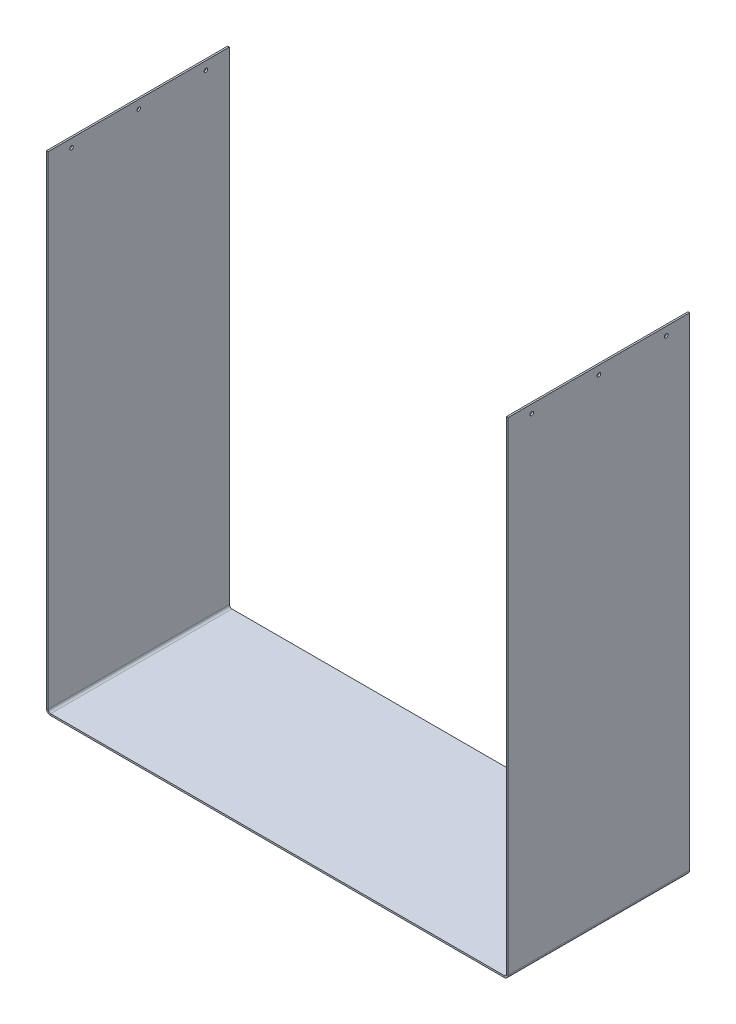
from build123d import *

# Parameters (mm, degrees)
SZKIC1_W                             = 546
SZKIC1_H                             = 216
ODGI_CIE_BAZOWE1_DEPTH               = 2
ODGI_CIE_KRAW_DZI1_STRIP_W           = 14
ODGI_CIE_KRAW_DZI1_STRIP_H           = 2
ODGI_CIE_KRAW_DZI1_STRIP_CUT_DEPTH   = 216
ODGI_CIE_KRAW_DZI1_STRIP_2_W         = 14
ODGI_CIE_KRAW_DZI1_STRIP_2_H         = 2
ODGI_CIE_KRAW_DZI1_STRIP_CUT_2_DEPTH = 216
ODGI_CIE_KRAW_DZI1_DEPTH             = 216
ODGI_CIE_KRAW_DZI1_BEND_DEPTH        = 216
SZKIC12_R                            = 2.1
WYTNIJ_WYCI_GNI_CIE1_DEPTH           = 806.138497403


# Sheet-metal steps are written as plain solids
with BuildPart() as part:
    # Szkic1 → Odgięcie bazowe1 (new body)
    with BuildSketch(Plane(origin=(0, 0, 0), x_dir=(1, 0, 0), z_dir=(0, 1, 0))):
        Rectangle(SZKIC1_W, SZKIC1_H)
    extrude(amount=-ODGI_CIE_BAZOWE1_DEPTH)

    # Odgięcie krawędzi1 strip (across the edge) → Odgięcie krawędzi1 strip cut (cut)
    with BuildSketch(Plane(origin=(-273, 0, -108), x_dir=(1, 0, 0), z_dir=(0, 0, 1))):
        with Locations((-4, -1)):
            Rectangle(ODGI_CIE_KRAW_DZI1_STRIP_W, ODGI_CIE_KRAW_DZI1_STRIP_H)
    extrude(amount=ODGI_CIE_KRAW_DZI1_STRIP_CUT_DEPTH, mode=Mode.SUBTRACT)

    # Odgięcie krawędzi1 strip 2 (across the edge) → Odgięcie krawędzi1 strip cut 2 (cut)
    with BuildSketch(Plane(origin=(273, 0, 108), x_dir=(-1, 0, 0), z_dir=(0, 0, -1))):
        with Locations((-4, -1)):
            Rectangle(ODGI_CIE_KRAW_DZI1_STRIP_2_W, ODGI_CIE_KRAW_DZI1_STRIP_2_H)
    extrude(amount=ODGI_CIE_KRAW_DZI1_STRIP_CUT_2_DEPTH, mode=Mode.SUBTRACT)

    # Odgięcie krawędzi1 section (across the edge) → Odgięcie krawędzi1 (add)
    with BuildSketch(Plane(origin=(-273, 0, -108), x_dir=(1, 0, 0), z_dir=(0, 0, 1))):
        with BuildLine():
            Line((-2, 3), (-2, 578))
            Line((-2, 578), (0, 578))
            Line((0, 578), (0, 3))
            ThreePointArc((0, 3), (0.878679656, 0.878679656), (3, 0))
            Line((3, 0), (3, -2))
            ThreePointArc((3, -2), (-0.535533906, -0.535533906), (-2, 3))
        make_face()
    extrude(amount=ODGI_CIE_KRAW_DZI1_DEPTH)

    # Odgięcie krawędzi1 section 2 (across the edge) → Odgięcie krawędzi1 bend (add)
    with BuildSketch(Plane(origin=(273, 0, 108), x_dir=(-1, 0, 0), z_dir=(0, 0, -1))):
        with BuildLine():
            Line((-2, 3), (-2, 578))
            Line((-2, 578), (0, 578))
            Line((0, 578), (0, 3))
            ThreePointArc((0, 3), (0.878679656, 0.878679656), (3, 0))
            Line((3, 0), (3, -2))
            ThreePointArc((3, -2), (-0.535533906, -0.535533906), (-2, 3))
        make_face()
    extrude(amount=ODGI_CIE_KRAW_DZI1_BEND_DEPTH)

    # Szkic12 → Wytnij-wyciągnięcie1 (cut, through all)
    with BuildSketch(Plane.ZY.offset(275)):
        with Locations(Location((0, 568, 0), (0, 0, 270))):
            Circle(SZKIC12_R)
        with Locations(Location((80, 568, 0), (0, 0, 270))):
            Circle(SZKIC12_R)
        with Locations(Location((-80, 568, 0), (0, 0, 270))):
            Circle(SZKIC12_R)
    extrude(amount=-WYTNIJ_WYCI_GNI_CIE1_DEPTH, mode=Mode.SUBTRACT)


solid = part.part
